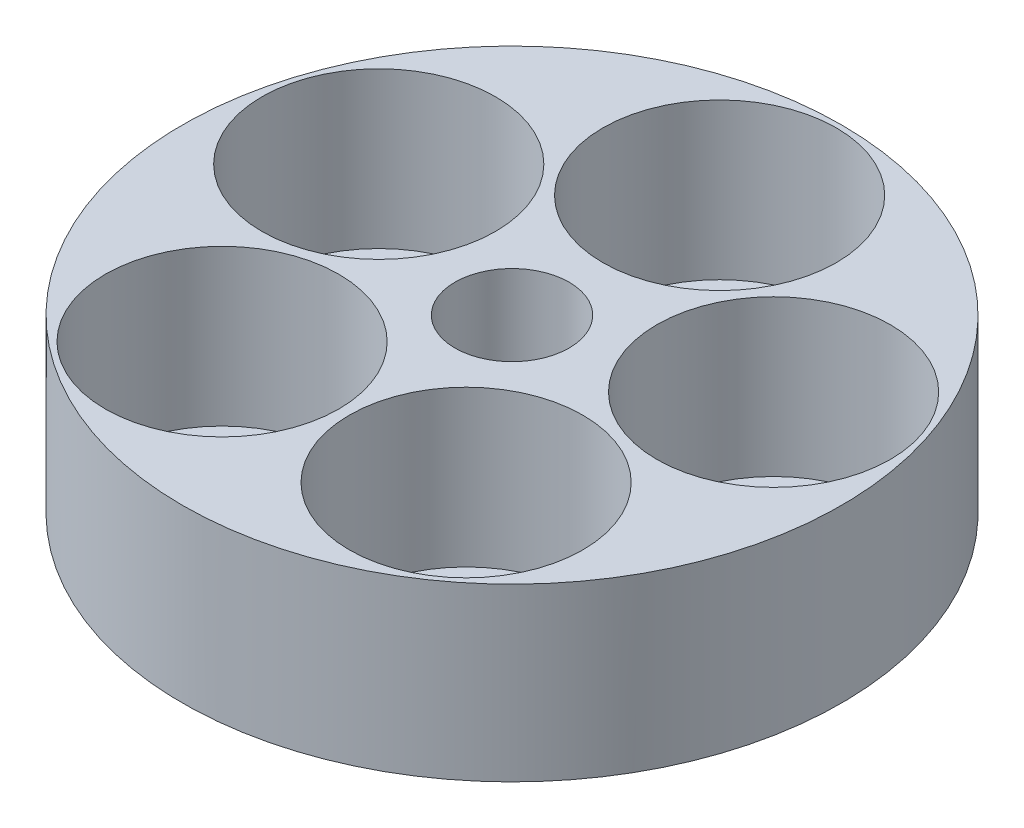
from build123d import *

# Parameters (mm, degrees)
SKETCH1_R           = 63.5
SKETCH1_R_2         = 22.5
SKETCH1_R_3         = 11
BOSS_EXTRUDE1_DEPTH = 30
BOSS_EXTRUDE2_START = 3
SKETCH4_R           = 63.5
SKETCH4_R_2         = 11
BOSS_EXTRUDE2_DEPTH = 3


with BuildPart() as part:
    # Sketch1 → Boss-Extrude1 (new body)
    with BuildSketch(Plane(origin=(0, 0, 0), x_dir=(1, 0, 0), z_dir=(0, 1, 0))):
        Circle(SKETCH1_R)
        with Locations((38.042260652, 12.360679775)):
            Circle(SKETCH1_R_2, mode=Mode.SUBTRACT)
        with Locations((0, 40)):
            Circle(SKETCH1_R_2, mode=Mode.SUBTRACT)
        with Locations((-38.042260652, 12.360679775)):
            Circle(SKETCH1_R_2, mode=Mode.SUBTRACT)
        with Locations((-23.511410092, -32.360679775)):
            Circle(SKETCH1_R_2, mode=Mode.SUBTRACT)
        with Locations((23.511410092, -32.360679775)):
            Circle(SKETCH1_R_2, mode=Mode.SUBTRACT)
        Circle(SKETCH1_R_3, mode=Mode.SUBTRACT)
    extrude(amount=BOSS_EXTRUDE1_DEPTH)

    # Sketch4 → Boss-Extrude2 (add)
    with BuildSketch(Plane.XZ.offset(BOSS_EXTRUDE2_START)):
        Circle(SKETCH4_R)
        Circle(SKETCH4_R_2, mode=Mode.SUBTRACT)
    extrude(amount=-BOSS_EXTRUDE2_DEPTH)


solid = part.part
